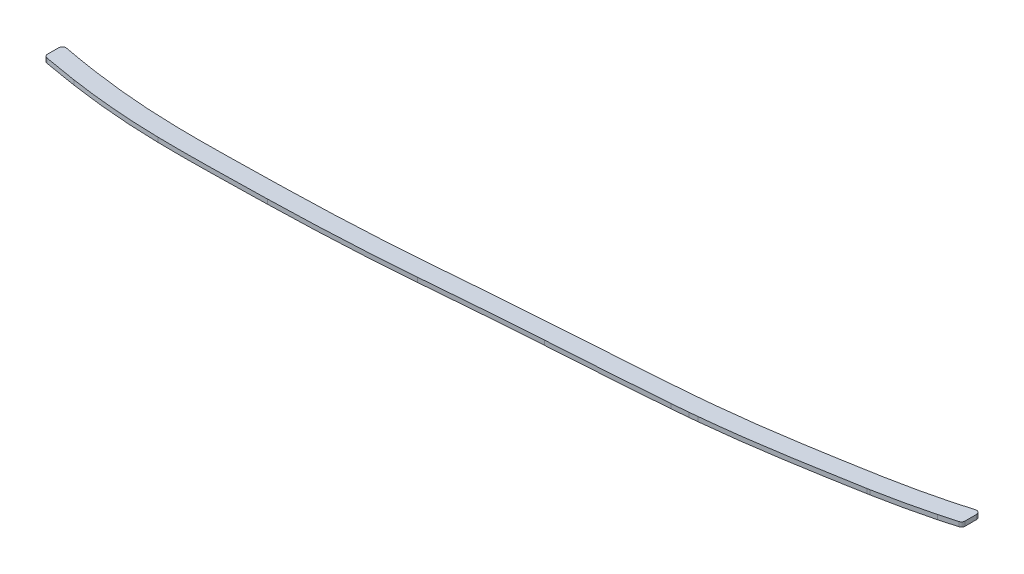
from build123d import *

# Parameters (mm, degrees)
BOSS_EXTRUDE1_START = -1.5875
BOSS_EXTRUDE1_DEPTH = 3.175
FILLET1_R           = 2.54


# Read off the part's stored shape, not the designer's step: Boss-Extrude1
with BuildPart() as part:
    # Boss-Extrude1 outline → Boss-Extrude1 (new body)
    with BuildSketch(Plane(origin=(0, 0, 0), x_dir=(1, 0, 0), z_dir=(0, 1, 0)).offset(BOSS_EXTRUDE1_START)):
        with BuildLine():
            add(Edge.make_bspline(
                [(701.573370465, -71.674259434), (702.04697488, -71.626796619), (702.961854911, -71.534187022), (704.527211696, -71.372087014), (706.256268563, -71.189411511), (708.433468196, -70.954566837), (711.038260137, -70.66442021), (715.259153852, -70.176918919), (720.517449562, -69.537326192), (728.939784684, -68.449094171), (739.471043309, -66.973596397), (752.121699379, -65.058370184), (764.774270693, -63.022725712), (775.332382372, -61.245644149), (783.768221701, -59.789793136), (790.217423582, -58.659365862), (795.556531692, -57.710632329), (799.706029598, -56.965839367), (801.743713725, -56.597532565), (802.76701547, -56.411910209)],
                knots=[1.1996e-05, 1.1996e-05, 1.1996e-05, 1.1996e-05, 0.015636808, 0.031261621, 0.046886433, 0.062511246, 0.093760871, 0.125010496, 0.187509746, 0.250008997, 0.375007497, 0.500005998, 0.625004498, 0.750002999, 0.812502249, 0.875001499, 0.93750075, 0.968750375, 1, 1, 1, 1], degree=3))
            add(Edge.make_bspline(
                [(696.057912544, -72.218303811), (696.516819195, -72.173843609), (697.434189716, -72.08448281), (698.812500771, -71.948951554), (700.191895387, -71.812223809), (701.113019016, -71.720314305), (701.573370465, -71.674259434)],
                knots=[0.000436824, 0.000436824, 0.000436824, 0.000436824, 0.250279009, 0.500121194, 0.749963378, 0.999805563, 0.999805563, 0.999805563, 0.999805563], degree=3))
            add(Edge.make_bspline(
                [(684.465771861, -73.258588893), (685.427037387, -73.178353817), (687.338409796, -73.01607439), (690.270265001, -72.757917882), (693.135698373, -72.496722872), (695.087462196, -72.311946881), (696.057912544, -72.218303811)],
                knots=[-3.996e-06, -3.996e-06, -3.996e-06, -3.996e-06, 0.249945754, 0.499895504, 0.749845254, 0.999795004, 0.999795004, 0.999795004, 0.999795004], degree=3))
            add(Edge.make_bspline(
                [(602.42420841, -79.030202072), (604.074214061, -78.917973041), (607.327656264, -78.697993222), (612.488020924, -78.352754528), (617.82142797, -77.998720132), (624.748165187, -77.541006681), (633.288768179, -76.978079707), (643.562499486, -76.293021789), (653.811394813, -75.590339748), (662.341271598, -74.981221252), (669.157253218, -74.473896148), (673.963588211, -74.106706625), (678.141033863, -73.776630779), (681.719672317, -73.486306526), (683.554235836, -73.334679882), (684.465771861, -73.258588893)],
                knots=[4.679e-06, 4.679e-06, 4.679e-06, 4.679e-06, 0.062504419, 0.125004159, 0.1875039, 0.25000364, 0.375003121, 0.500002601, 0.625002082, 0.750001563, 0.812501303, 0.875001043, 0.937500783, 0.968750654, 1.000000524, 1.000000524, 1.000000524, 1.000000524], degree=3))
            add(Edge.make_bspline(
                [(520.17866376, -85.310815783), (520.948622537, -85.247475703), (522.472990474, -85.121954498), (525.646023872, -84.860432492), (529.954540392, -84.505420462), (535.485636827, -84.050761487), (540.7029418, -83.623505808), (545.828810606, -83.207047886), (550.972711882, -82.793890253), (556.116782859, -82.386921041), (562.976897794, -81.853433898), (571.571389273, -81.203899916), (581.568137842, -80.474939815), (590.024015055, -79.880194977), (597.052441707, -79.396103056), (600.639671821, -79.151478022), (602.42420841, -79.030202072)],
                knots=[1.3823e-05, 1.3823e-05, 1.3823e-05, 1.3823e-05, 0.031263258, 0.062512694, 0.125011564, 0.187510435, 0.250009305, 0.312508176, 0.375007046, 0.437505917, 0.500004787, 0.625002528, 0.750000269, 0.87499801, 0.937496881, 0.999995751, 0.999995751, 0.999995751, 0.999995751], degree=3))
            add(Edge.make_bspline(
                [(421.564796931, -90.347249187), (422.61109619, -90.324190198), (424.721066812, -90.275643156), (427.781390104, -90.199626606), (430.822063258, -90.118782847), (434.941029322, -90.002532976), (440.08484045, -89.844168641), (452.427619866, -89.421521336), (466.822115937, -88.804267378), (483.25535308, -87.910089241), (493.52068453, -87.276342604), (501.726177762, -86.718361924), (507.872215251, -86.275368153), (512.780927318, -85.902800926), (516.950869137, -85.573515025), (519.108912611, -85.398645627), (520.17866376, -85.310815783)],
                knots=[7.203e-06, 7.203e-06, 7.203e-06, 7.203e-06, 0.031256675, 0.062506146, 0.093755618, 0.125005089, 0.187504032, 0.250002975, 0.499998747, 0.624996633, 0.749994519, 0.812493462, 0.874992405, 0.937491348, 0.968740819, 0.999990291, 0.999990291, 0.999990291, 0.999990291], degree=3))
            add(Edge.make_bspline(
                [(346.714675087, -91.169822314), (347.184634959, -91.179549272), (348.149283989, -91.198362445), (349.881001429, -91.228640124), (351.370820969, -91.250109563), (353.638345707, -91.276445536), (356.741777131, -91.30289862), (360.603346067, -91.318288447), (365.253131479, -91.312388009), (369.910166762, -91.284169995), (376.135587827, -91.222367993), (383.937832745, -91.109503558), (391.757720532, -90.96544109), (398.23665113, -90.836219907), (403.230594411, -90.734014325), (408.182903858, -90.630969164), (412.914025095, -90.531986169), (416.611599734, -90.454119205), (419.474951766, -90.392792196), (420.864689854, -90.36259776), (421.564796931, -90.347249187)],
                knots=[1.1e-08, 1.1e-08, 1.1e-08, 1.1e-08, 0.015624829, 0.031249657, 0.062499315, 0.093748972, 0.12499863, 0.187497945, 0.24999726, 0.312496575, 0.37499589, 0.49999452, 0.62499315, 0.687492464, 0.749991779, 0.812491094, 0.874990409, 0.937489724, 0.968739382, 0.999989039, 0.999989039, 0.999989039, 0.999989039], degree=3))
            add(Edge.make_bspline(
                [(284.660180705, -86.02436228), (285.273667186, -86.114656759), (286.466569449, -86.288293963), (288.463107874, -86.571590524), (290.46491743, -86.848444068), (293.02699573, -87.19252046), (296.252166304, -87.606710304), (301.400962421, -88.226261718), (307.844767088, -88.921476193), (315.590478493, -89.626291032), (322.05207179, -90.106744711), (327.225920355, -90.425587153), (330.470644664, -90.599377294), (333.059733967, -90.723413499), (335.02192621, -90.809363102), (336.835778016, -90.883623075), (338.1694462, -90.935956115), (339.489700776, -90.98142965), (341.397886756, -91.039617592), (343.443225624, -91.094945655), (345.255837503, -91.138480537), (346.23440638, -91.159881953), (346.714675087, -91.169822314)],
                knots=[0, 0, 0, 0, 0.03125, 0.0625, 0.09375, 0.125, 0.1875, 0.25, 0.375, 0.5, 0.625, 0.6875, 0.75, 0.78125, 0.8125, 0.84375, 0.875, 0.90625, 0.9375, 0.96875, 0.984375, 1, 1, 1, 1], degree=3))
            add(Edge.make_bspline(
                [(258.083552795, -81.475395447), (258.347968296, -81.526862936), (258.876883054, -81.629439687), (259.670508063, -81.782232521), (260.729004783, -81.984533344), (265.19336261, -82.828339408), (273.252215122, -84.264018509), (280.795301047, -85.455519597), (284.660180705, -86.02436228)],
                knots=[0.425011658, 0.425011658, 0.425011658, 0.425011658, 0.442241189, 0.459470721, 0.476700252, 0.511159315, 0.75, 1, 1, 1, 1], degree=3))
            Line((258.083552795, -81.475395447), (258.083552795, -94.40861288))
            add(Edge.make_bspline(
                [(282.810885884, -98.588999508), (274.906267762, -97.425577983), (267.032082315, -96.096692803), (258.818160589, -94.548151889), (258.450825612, -94.478551371), (258.083552795, -94.40861288)],
                knots=[0, 0, 0, 0, 0.5, 0.5, 0.523411439, 0.523411439, 0.523411439, 0.523411439], degree=3))
            add(Edge.make_bspline(
                [(282.810885884, -98.588999508), (283.589001764, -98.703524555), (285.164508504, -98.932181064), (287.829592849, -99.306686744), (290.382113422, -99.652796041), (292.96654593, -99.989964246), (295.582618612, -100.317621114), (298.230083081, -100.634886778), (300.908649594, -100.941019762), (303.61800528, -101.235303734), (306.357810596, -101.517085869), (309.127700691, -101.785780175), (311.92729165, -102.040857239), (316.290106771, -102.412643883), (322.527800913, -102.877083333), (328.625603501, -103.227822262), (333.380129051, -103.452212237), (336.816790701, -103.594408746), (339.260438836, -103.686034081), (343.688375923, -103.809905452), (346.451873128, -103.867102934)],
                knots=[0, 0, 0, 0, 0.039344948, 0.07917436, 0.119484401, 0.160271019, 0.201529957, 0.243256752, 0.285446746, 0.328095093, 0.37119677, 0.414746584, 0.458739194, 0.503169123, 0.620303495, 0.752369719, 0.789892337, 0.843756099, 0.913843268, 1, 1, 1, 1], degree=3))
            add(Edge.make_bspline(
                [(346.451873128, -103.867102934), (347.517721695, -103.889163254), (349.542313965, -103.92559437), (351.410670783, -103.951601003), (353.733077388, -103.97802022), (356.595805361, -104.001616052), (359.303450326, -104.013254143), (361.856652408, -104.015647305), (363.59855953, -104.013876583), (367.980988834, -104.00146953), (374.772600805, -103.943346872), (385.553908564, -103.787153573), (397.279033824, -103.561287268), (410.957604412, -103.27591363), (418.412993695, -103.119398813), (421.843885938, -103.044182276)],
                knots=[0, 0, 0, 0, 0.033933195, 0.066295354, 0.097094988, 0.12634023, 0.180197875, 0.204824218, 0.227923989, 0.249502809, 0.379187752, 0.498147003, 0.678500622, 0.845778388, 1, 1, 1, 1], degree=3))
            add(Edge.make_bspline(
                [(421.843885938, -103.044182276), (423.284501257, -103.01243375), (426.138074601, -102.945774905), (430.23392379, -102.840101392), (434.371968877, -102.72425222), (439.798819101, -102.559925422), (448.025157593, -102.283759658), (459.021003941, -101.848637215), (471.45249354, -101.271082202), (483.913686147, -100.593406887), (494.231772367, -99.956980278), (502.466387344, -99.39745886), (508.578998405, -98.957752379), (514.573610191, -98.503827918), (518.958126171, -98.153760061), (521.218891036, -97.968142841)],
                knots=[0, 0, 0, 0, 0.042442699, 0.084473439, 0.126075796, 0.167232557, 0.248140272, 0.374197286, 0.498957981, 0.623287397, 0.750390596, 0.810583593, 0.872090979, 0.935130561, 1, 1, 1, 1], degree=3))
            add(Edge.make_bspline(
                [(521.218891036, -97.968142841), (523.451350188, -97.784491424), (528.137879673, -97.397889698), (536.731309482, -96.690817555), (544.954460679, -96.018267543), (553.50407331, -95.33057133), (563.716480518, -94.531063336), (575.636513939, -93.635190253), (588.786212869, -92.692538058), (598.347131864, -92.036570917), (603.285671904, -91.700951094)],
                knots=[0, 0, 0, 0, 0.091538543, 0.187736577, 0.288050862, 0.392265043, 0.500367872, 0.66142166, 0.827962884, 1, 1, 1, 1], degree=3))
            add(Edge.make_bspline(
                [(603.285671904, -91.700951094), (605.78808228, -91.530743591), (610.897032353, -91.186403467), (619.306599861, -90.627823918), (627.538601032, -90.084789882), (635.936476676, -89.530098998), (643.719546666, -89.009847824), (650.893783861, -88.520535985), (657.46530725, -88.061941255), (664.220349455, -87.576914876), (671.158631923, -87.060362733), (677.768426526, -86.549575155), (682.892578542, -86.13408317), (685.522190682, -85.9145748)],
                knots=[0, 0, 0, 0, 0.096041268, 0.194096291, 0.29416615, 0.396252661, 0.500358628, 0.578021943, 0.657927659, 0.740076076, 0.824468696, 0.911108458, 1, 1, 1, 1], degree=3))
            add(Edge.make_bspline(
                [(685.522190682, -85.9145748), (686.483363358, -85.834347474), (688.416317483, -85.670266195), (691.375399642, -85.409794673), (694.295027309, -85.143745348), (696.281480154, -84.95572275), (697.280162315, -84.859352478)],
                knots=[0, 0, 0, 0, 0.247890437, 0.497182912, 0.747883707, 1, 1, 1, 1], degree=3))
            add(Edge.make_bspline(
                [(697.280162315, -84.859352478), (699.133498258, -84.679799353), (700.986276607, -84.496390936), (702.838684367, -84.311070025)],
                knots=[0, 0, 0, 0, 1, 1, 1, 1], degree=3))
            add(Edge.make_bspline(
                [(702.838684367, -84.311070025), (703.589775295, -84.235799752), (705.133492987, -84.078629058), (708.047466313, -83.771407142), (710.748991263, -83.476233306), (713.523455705, -83.162791229), (716.37085234, -82.830812164), (719.291149506, -82.479719712), (722.284334057, -82.109050619), (725.350396028, -81.718303946), (730.760173437, -81.009658613), (740.331799838, -79.683632118), (753.598097399, -77.68903736), (767.27468421, -75.481732644), (778.677358422, -73.559116698), (788.170711893, -71.915943965), (796.891357387, -70.375844053), (802.366731643, -69.391771369), (805.033747795, -68.907986576)],
                knots=[0, 0, 0, 0, 0.024848372, 0.050416521, 0.076704883, 0.103713975, 0.131444397, 0.159896834, 0.189072062, 0.218970945, 0.249594443, 0.347406526, 0.499390399, 0.638902952, 0.749436379, 0.834969029, 0.918499168, 1, 1, 1, 1], degree=3))
            Line((805.033747795, -68.907986576), (806.809551789, -68.578936168))
            add(Edge.make_bspline(
                [(806.809551789, -68.578936168), (807.794004822, -68.395119755), (809.726191369, -68.029713589), (811.766757719, -67.634799792), (814.185248792, -67.158567155), (816.55886725, -66.68111941), (820.369254046, -65.898841142), (824.807312319, -64.951185469), (829.827239229, -63.826217582), (833.268092373, -63.026324522), (835.935211118, -62.389425037), (837.873162846, -61.91853539), (839.769381429, -61.449895816), (841.624127129, -60.983575945), (843.734931971, -60.443149682), (844.733875611, -60.183258894), (845.223156672, -60.055102096)],
                knots=[0, 0, 0, 0, 0.064848776, 0.128591831, 0.191223632, 0.252742215, 0.313148507, 0.487734154, 0.598660779, 0.705288655, 0.75701083, 0.807682273, 0.85731034, 0.905901891, 0.953463218, 1, 1, 1, 1], degree=3))
            add(Edge.make_bspline(
                [(858.805970467, -56.257210913), (854.302265416, -57.602424975), (849.773135735, -58.863331563), (845.223156672, -60.055102096)],
                knots=[0.525572557, 0.525572557, 0.525572557, 0.525572557, 1, 1, 1, 1], degree=3))
            Line((858.805970467, -56.257210913), (858.805970467, -42.981654463))
            add(Edge.make_bspline(
                [(842.005216089, -47.769547229), (844.33209519, -47.160070589), (848.630876213, -45.996859499), (853.420502494, -44.614540459), (856.161610787, -43.791878163), (857.220661541, -43.470009626), (858.013965236, -43.226852548), (858.542087125, -43.063586295), (858.805970467, -42.981654463)],
                knots=[0, 0, 0, 0, 0.25, 0.462204418, 0.52007177, 0.549005446, 0.577939123, 0.606872799, 0.606872799, 0.606872799, 0.606872799], degree=3))
            add(Edge.make_bspline(
                [(804.478503109, -56.094697623), (804.937261418, -56.009038578), (805.873535899, -55.833158182), (807.593890186, -55.506511486), (809.223478159, -55.191529302), (811.577863033, -54.728351346), (814.728198308, -54.095426794), (818.65467417, -53.281335813), (823.355137668, -52.264852214), (828.043123472, -51.207419322), (831.9339187, -50.292144023), (835.047083584, -49.53591133), (836.970069876, -49.058975401), (838.551971708, -48.659746263), (839.885294081, -48.319263071), (841.0585054, -48.016793361), (841.676038434, -47.855768334), (842.005216089, -47.769547229)],
                knots=[0, 0, 0, 0, 0.03125, 0.0625, 0.125, 0.1875, 0.25, 0.375, 0.5, 0.625, 0.75, 0.8125, 0.875, 0.90625, 0.9375, 0.96875, 1, 1, 1, 1], degree=3))
            Line((804.478503109, -56.094697623), (802.76701547, -56.411910209))
        make_face()
    extrude(amount=BOSS_EXTRUDE1_DEPTH)

    # Fillet1
    fillet1_edges = [part.edges().sort_by_distance(p)[0] for p in [
        (858.805970467, 0, 42.981654463),
        (858.805970467, 0, 56.257210913),
        (258.083552795, 0, 81.475395447),
        (258.083552795, 0, 94.40861288),
    ]]
    fillet(fillet1_edges, radius=FILLET1_R)


solid = part.part
